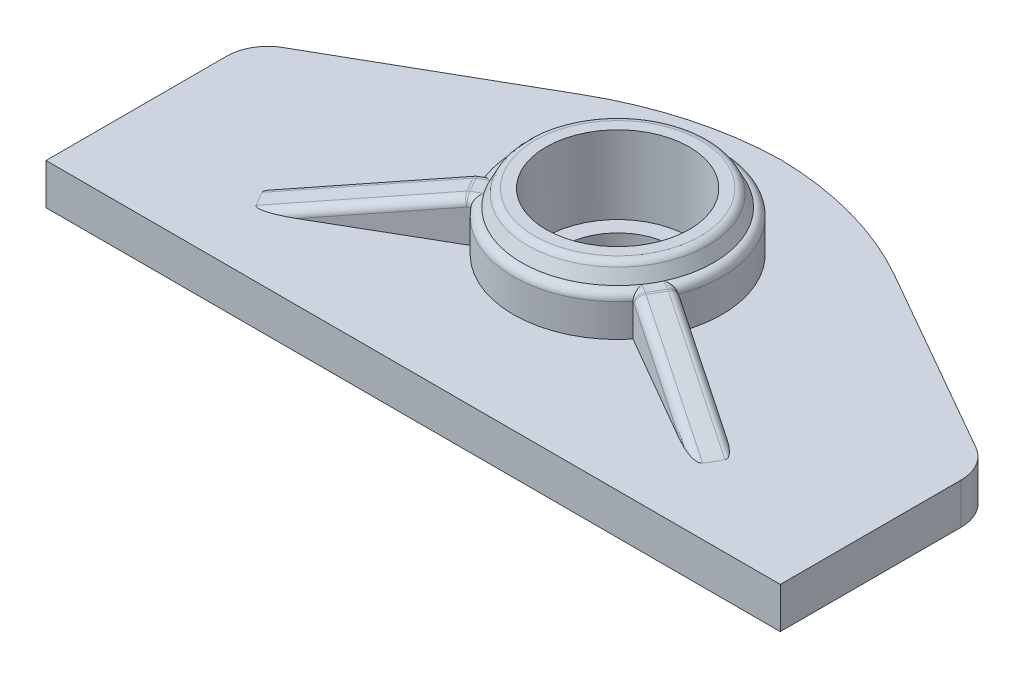
from build123d import *
from OCP.BRepFilletAPI import BRepFilletAPI_MakeChamfer

# Parameters (mm, degrees)
SKETCH_1_R       = 3.5
EXTRUDE_1_DEPTH  = 2
FILLET_1_R       = 2
FILLET_2_R       = 16
SKETCH_2_R       = 5.1000000000000005
SKETCH_2_R_2     = 3.5
EXTRUDE_2_DEPTH  = 2
SKETCH_3_R       = 3.5
SKETCH_3_R_2     = 2.7
EXTRUDE_3_DEPTH  = 1
EXTRUDE_4_DEPTH  = 2
CHAMFER_1_SIZE   = 7.6
CHAMFER_1_SIZE_2 = 2
FILLET_3_R       = 0.4
SKETCH_5_R       = 4.3
SKETCH_5_R_2     = 3.5
EXTRUDE_5_DEPTH  = 0.8
CHAMFER_2_SIZE2  = 0.8
CHAMFER_2_SIZE   = 0.4


with BuildPart() as part:
    # Эскиз1 → Бобышка-Вытянуть1 (new body)
    with BuildSketch(Plane(origin=(0, 0, 0), x_dir=(1, 0, 0), z_dir=(0, 1, 0))):
        Polygon((-17.95, 2.0000000000000018), (-3.950000000000008, 10), (3.9499999999999997, 10), (17.95, 2.0000000000000018), (17.949999999999996, -7.999999999999998), (-17.950000000000006, -7.999999999999998), align=None)
        with Locations(Location((0, 2.0000000000000018, 0), (0, 0, 270))):
            Circle(SKETCH_1_R, mode=Mode.SUBTRACT)
    extrude(amount=EXTRUDE_1_DEPTH)

    # Скругление1
    fillet_1_edges = [part.edges().sort_by_distance(p)[0] for p in [
        (-17.95, 1, -2.0000000000000018),
        (17.95, 1, -2.0000000000000018),
    ]]
    fillet(fillet_1_edges, radius=FILLET_1_R)

    # Скругление2
    # the kernel refuses this fillet: 16 mm, written as the material it takes off along each edge
    with BuildSketch(Plane(origin=(3.9499999999999997, -10.622577482985493, -10), x_dir=(-1, 0, 0), z_dir=(0, 1, 0))) as fillet_2_piece_1:
        with BuildLine():
            CenterArc((FILLET_2_R * 0.265564437075, FILLET_2_R), FILLET_2_R, 240.25511870305778, 29.744881296942253)
            Line((-FILLET_2_R * 0.230574501282, FILLET_2_R * 0.131756857876), (0, 0))
            Line((0, 0), (FILLET_2_R * 0.265564437075, 0))
        make_face()
    extrude(amount=23.245154965970986, mode=Mode.SUBTRACT)
    with BuildSketch(Plane(origin=(-3.950000000000008, -10.6225774829855, -10), x_dir=(-0.8682431421244592, 0, 0.496138938356834), z_dir=(0, 1, 0))) as fillet_2_piece_2:
        with BuildLine():
            CenterArc((FILLET_2_R * 0.265564437075, FILLET_2_R), FILLET_2_R, 240.25511870305778, 29.744881296942253)
            Line((-FILLET_2_R * 0.230574501282, FILLET_2_R * 0.131756857876), (0, 0))
            Line((0, 0), (FILLET_2_R * 0.265564437075, 3e-17))
        make_face()
    extrude(amount=23.245154965971, mode=Mode.SUBTRACT)

    # Эскиз2 → Бобышка-Вытянуть2 (add)
    with BuildSketch(Plane(origin=(0, 2, 0), x_dir=(1, 0, 0), z_dir=(0, 1, 0))):
        with Locations(Location((0, 2.0000000000000018, 0), (0, 0, 270))):
            Circle(SKETCH_2_R)
        with Locations(Location((0, 2.0000000000000018, 0), (0, 0, 270))):
            Circle(SKETCH_2_R_2, mode=Mode.SUBTRACT)
    extrude(amount=EXTRUDE_2_DEPTH)

    # Эскиз3 → Бобышка-Вытянуть3 (add)
    with BuildSketch(Plane.XZ):
        with Locations(Location((0, -2.0000000000000018, 0), (0, 0, 270))):
            Circle(SKETCH_3_R)
        with Locations(Location((0, -2.0000000000000018, 0), (0, 0, 270))):
            Circle(SKETCH_3_R_2, mode=Mode.SUBTRACT)
    extrude(amount=-EXTRUDE_3_DEPTH)

    # Эскиз4 → Бобышка-Вытянуть4 (add)
    with BuildSketch(Plane(origin=(0, 2, 0), x_dir=(1, 0, 0), z_dir=(0, 1, 0))):
        Polygon((-4.762052269287931, 0.1743882711349406), (-11.517050418806543, -3.7256117288650747), (-10.717050418806545, -5.111252374920166), (-3.962052269287931, -1.2112523749201587), align=None)
        Polygon((10.717050418806549, -5.111252374920164), (3.9620522692879283, -1.2112523749201598), (4.762052269287931, 0.17438827113494176), (11.517050418806543, -3.7256117288650716), align=None)
    extrude(amount=EXTRUDE_4_DEPTH)

    # Фаска1
    chamfer_1_edges_1 = [part.edges().sort_by_distance(p)[0] for p in [
        (11.117050418806546, 4, 4.4184320518926175),
    ]]
    chamfer_1_side_1 = [part.faces().sort_by_distance(p)[0] for p in [
        (11.082409402655168, 4, 4.398432051892618),
    ]]
    chamfer_1_edges_2 = [part.edges().sort_by_distance(p)[0] for p in [
        (-11.117050418806544, 4, 4.418432051892621),
    ]]
    chamfer_1_side_2 = [part.faces().sort_by_distance(p)[0] for p in [
        (-11.117050418806544, 3.96, 4.418432051892621),
    ]]
    chamfer_1 = BRepFilletAPI_MakeChamfer(part.part.solid().wrapped)
    for e in chamfer_1_edges_1:
        chamfer_1.Add(CHAMFER_1_SIZE - 0.0001, CHAMFER_1_SIZE_2 - 0.0001, e.wrapped, chamfer_1_side_1[0].wrapped)
    for e in chamfer_1_edges_2:
        chamfer_1.Add(CHAMFER_1_SIZE_2 - 0.0001, CHAMFER_1_SIZE - 0.0001, e.wrapped, chamfer_1_side_2[0].wrapped)
    add(Compound.cast(chamfer_1.Shape()), mode=Mode.REPLACE)  # a hair under: the kernel refuses the full size

    # Скругление3
    fillet_3_edges = [part.edges().sort_by_distance(p)[0] for p in [
        (-4.4e-16, 4, 3.0999999999999996),
        (-4.8486981109365646, 4, -0.12436327113494033),
        (1.56e-15, 4, -7.100000000000002),
        (4.048698110936562, 4, 1.26127737492016),
        (4.848698110936564, 4, -0.12436327113494196),
        (-4.048698110936564, 4, 1.2612773749201591),
        (-4.535343952585196, 4, 0.6184820518926083),
        (4.535343952585196, 4, 0.6184820518926085),
        (8.22619718569587, 3.00005, 1.8256367288650646),
        (7.426197185695872, 3.0000500000000003, 3.2112773749201624),
        (-7.426197185695871, 3.000049999999999, 3.2112773749201633),
        (-8.22619718569587, 3.0000499999999994, 1.8256367288650677),
    ]]
    fillet(fillet_3_edges, radius=FILLET_3_R)

    # Эскиз5 → Бобышка-Вытянуть5 (add)
    with BuildSketch(Plane(origin=(0, 4, 0), x_dir=(1, 0, 0), z_dir=(0, 1, 0))):
        with Locations(Location((0, 2.0000000000000018, 0), (0, 0, 270))):
            Circle(SKETCH_5_R)
        with Locations(Location((0, 2.0000000000000018, 0), (0, 0, 90))):
            Circle(SKETCH_5_R_2, mode=Mode.SUBTRACT)
    extrude(amount=EXTRUDE_5_DEPTH)

    # Фаска2
    chamfer_2_edges = [part.edges().sort_by_distance(p)[0] for p in [
        (1.32e-15, 4, -6.300000000000002),
    ]]
    chamfer_2_side = [part.faces().sort_by_distance(p)[0] for p in [
        (1.32e-15, 4, -6.308000000000002),
    ]]
    chamfer(chamfer_2_edges, length=CHAMFER_2_SIZE - 0.0001, length2=CHAMFER_2_SIZE2 - 0.0001, reference=chamfer_2_side[0])  # a hair under: the kernel refuses the full size

    # Скругление4: read off the stored shape, not the designer's step
    # Скругление4 outline → Скругление4 (revolve, cut)
    with BuildSketch(Plane.XY.offset(-2)):
        with BuildLine():
            ThreePointArc((4.052786405, 4.8), (4.263078849, 4.740260323), (4.410557281, 4.578885438))
            Line((4.410557281, 4.578885438), (4.410557281, 4.8))
            Line((4.410557281, 4.8), (4.052786405, 4.8))
        make_face()
    revolve(axis=Axis((0, 0, -2), (0, 1, 0)), mode=Mode.SUBTRACT)


solid = part.part
